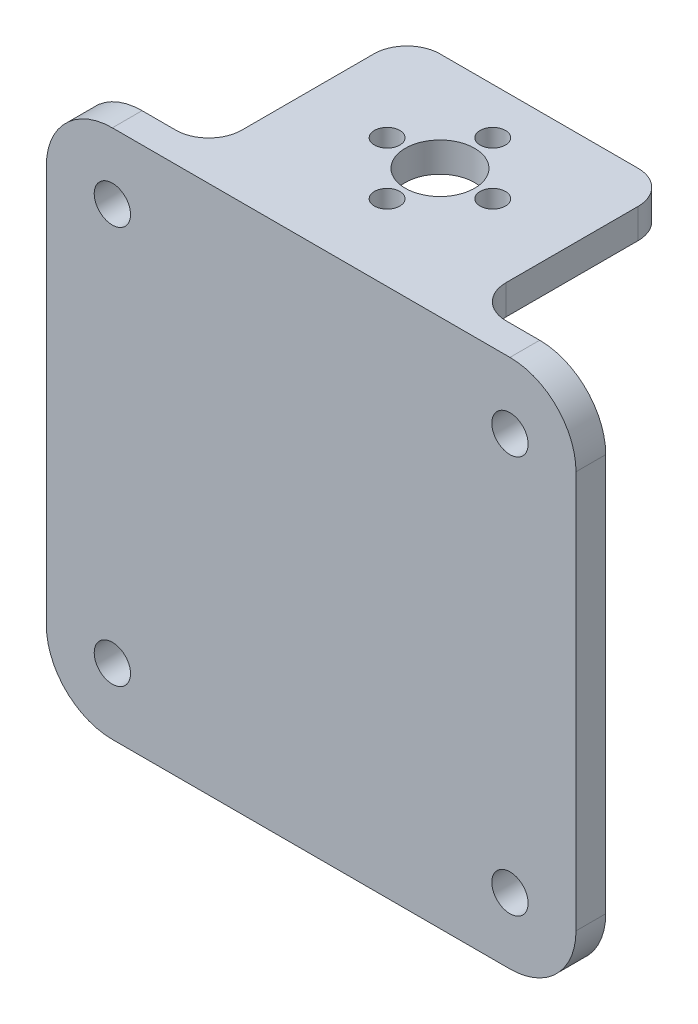
from build123d import *

# Parameters (mm, degrees)
SKETCH1_W            = 80.2
SKETCH1_H            = 80.2
BOSS_EXTRUDE1_DEPTH  = 4.5
M5_CLEARANCE_HOLE1_D = 5.5
SKETCH3_W            = 40
SKETCH3_H            = 4.5
BOSS_EXTRUDE2_DEPTH  = 30
CUT_EXTRUDE1_REACH   = 92.766
SKETCH4_R            = 5.25
CUT_EXTRUDE2_REACH   = 92.766
SKETCH5_R            = 1.924517265
FILLET2_R            = 10
FILLET4_R            = 5
FILLET3_R            = 5
CUT_EXTRUDE3_REACH   = 92.766
SKETCH6_R            = 11.25
FILLET5_R            = 5


with BuildPart() as part:
    # Sketch1 → Boss-Extrude1 (new body)
    with BuildSketch(Plane.XY):
        Rectangle(SKETCH1_W, SKETCH1_H)
    extrude(amount=BOSS_EXTRUDE1_DEPTH)

    # M5 Clearance Hole1 (through all)
    with Locations(Plane(origin=(-30.1, -30.1, 0), x_dir=(-1, 0, 0), z_dir=(0, 0, -1))):
        with Locations((0, 0), (-60.2, 60.2), (0, 60.2), (-60.2, 0)):
            Hole(M5_CLEARANCE_HOLE1_D / 2)

    # Sketch3 → Boss-Extrude2 (add)
    with BuildSketch(Plane(origin=(0, 0, 0), x_dir=(-1, 0, 0), z_dir=(0, 0, -1))):
        with Locations((0, 37.85)):
            Rectangle(SKETCH3_W, SKETCH3_H)
    extrude(amount=BOSS_EXTRUDE2_DEPTH)

    # Sketch4 → Cut-Extrude1 (cut, up to next)
    with BuildSketch(Plane(origin=(0, 35.6, 0), x_dir=(-1, 0, 0), z_dir=(0, -1, 0)), mode=Mode.PRIVATE) as cut_extrude1_sk1:
        with Locations((0, 15)):
            Circle(SKETCH4_R)
    cut_extrude1_tool1 = extrude(cut_extrude1_sk1.sketch, amount=-CUT_EXTRUDE1_REACH, mode=Mode.PRIVATE) & part.part
    add(cut_extrude1_tool1.solids().sort_by_distance((0, 35.6, -15))[0], mode=Mode.SUBTRACT)

    # Sketch5 → Cut-Extrude2 (cut, up to next)
    with BuildSketch(Plane.XZ.offset(-35.6), mode=Mode.PRIVATE) as cut_extrude2_sk1:
        with Locations((0, -23)):
            Circle(SKETCH5_R)
    cut_extrude2_tool1 = extrude(cut_extrude2_sk1.sketch, amount=-CUT_EXTRUDE2_REACH, mode=Mode.PRIVATE) & part.part
    # Sketch5 → Cut-Extrude2 (cut, up to next)
    with BuildSketch(Plane.XZ.offset(-35.6), mode=Mode.PRIVATE) as cut_extrude2_sk2:
        with Locations((-8, -15)):
            Circle(SKETCH5_R)
    cut_extrude2_tool2 = extrude(cut_extrude2_sk2.sketch, amount=-CUT_EXTRUDE2_REACH, mode=Mode.PRIVATE) & part.part
    # Sketch5 → Cut-Extrude2 (cut, up to next)
    with BuildSketch(Plane.XZ.offset(-35.6), mode=Mode.PRIVATE) as cut_extrude2_sk3:
        with Locations((0, -7)):
            Circle(SKETCH5_R)
    cut_extrude2_tool3 = extrude(cut_extrude2_sk3.sketch, amount=-CUT_EXTRUDE2_REACH, mode=Mode.PRIVATE) & part.part
    # Sketch5 → Cut-Extrude2 (cut, up to next)
    with BuildSketch(Plane.XZ.offset(-35.6), mode=Mode.PRIVATE) as cut_extrude2_sk4:
        with Locations((8, -15)):
            Circle(SKETCH5_R)
    cut_extrude2_tool4 = extrude(cut_extrude2_sk4.sketch, amount=-CUT_EXTRUDE2_REACH, mode=Mode.PRIVATE) & part.part
    add(cut_extrude2_tool1.solids().sort_by_distance((0, 35.6, -23))[0], mode=Mode.SUBTRACT)
    add(cut_extrude2_tool2.solids().sort_by_distance((-8, 35.6, -15))[0], mode=Mode.SUBTRACT)
    add(cut_extrude2_tool3.solids().sort_by_distance((0, 35.6, -7))[0], mode=Mode.SUBTRACT)
    add(cut_extrude2_tool4.solids().sort_by_distance((8, 35.6, -15))[0], mode=Mode.SUBTRACT)

    # Fillet2
    fillet2_edges = [part.edges().sort_by_distance(p)[0] for p in [
        (40.1, -40.1, 2.25),
        (-40.1, -40.1, 2.25),
        (-40.1, 40.1, 2.25),
        (40.1, 40.1, 2.25),
    ]]
    fillet(fillet2_edges, radius=FILLET2_R)

    # Fillet4
    fillet4_edges = [part.edges().sort_by_distance(p)[0] for p in [
        (0, 35.6, 0),
    ]]
    fillet(fillet4_edges, radius=FILLET4_R)

    # Fillet3
    fillet3_edges = [part.edges().sort_by_distance(p)[0] for p in [
        (-20, 37.85, -30),
        (20, 37.85, -30),
    ]]
    fillet(fillet3_edges, radius=FILLET3_R)

    # Sketch6 → Cut-Extrude3 (cut, up to next)
    with BuildSketch(Plane.XZ.offset(-35.6), mode=Mode.PRIVATE) as cut_extrude3_sk1:
        with Locations((0, -15)):
            Circle(SKETCH6_R)
    cut_extrude3_tool1 = extrude(cut_extrude3_sk1.sketch, amount=CUT_EXTRUDE3_REACH, mode=Mode.PRIVATE) & part.part
    add(cut_extrude3_tool1.solids().sort_by_distance((0, 35.6, -15))[0], mode=Mode.SUBTRACT)

    # Fillet5
    fillet5_edges = [part.edges().sort_by_distance(p)[0] for p in [
        (-20, 35.35, 0),
        (20, 35.35, 0),
    ]]
    fillet(fillet5_edges, radius=FILLET5_R)


solid = part.part
